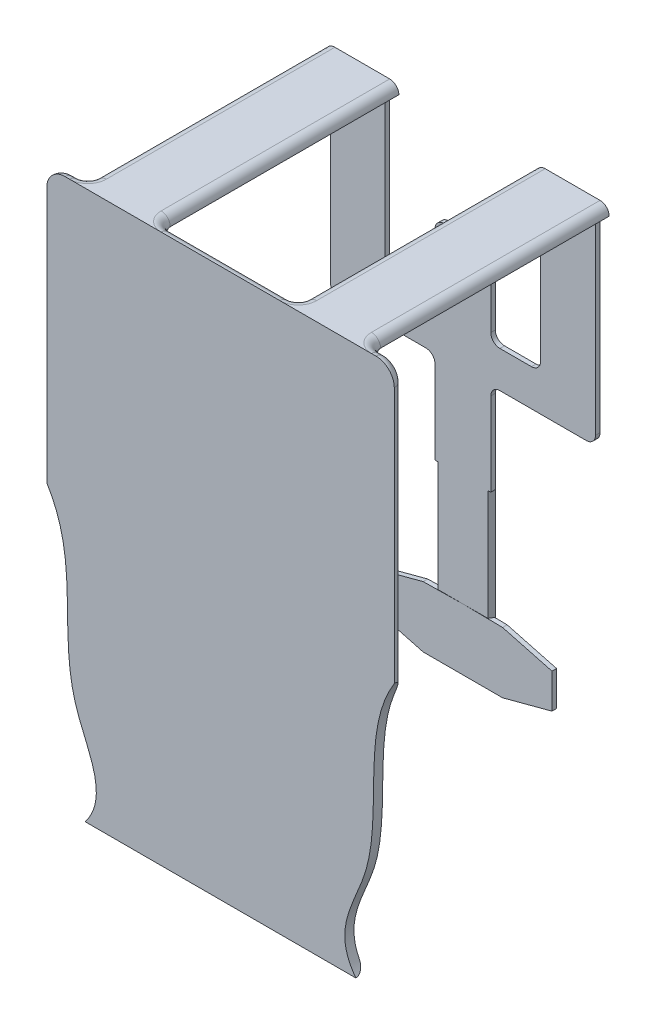
from build123d import *

# Parameters (mm, degrees)
BOSS_EXTRU_1_DEPTH      = 10
ESQUISSE2_W             = 80
ESQUISSE2_H             = 270
BOSS_EXTRU_2_DEPTH      = 10
CONG_1_R                = 10
ENL_V_MAT_EXTRU_1_DEPTH = 447.094160464
ESQUISSE5_W             = 60
ESQUISSE5_H             = 230
BOSS_EXTRU_3_DEPTH      = 5
BOSS_EXTRU_4_DEPTH      = 5
CONG_2_R                = 10
ENL_V_MAT_EXTRU_4_DEPTH = 121
BOSS_EXTRU_5_DEPTH      = 5


with BuildPart() as part:
    # Esquisse1 → Boss.-Extru.1 (new body)
    with BuildSketch(Plane.XY):
        with BuildLine():
            Line((-170, 300), (170, 300))
            ThreePointArc((170, 300), (184.142135624, 294.142135624), (190, 280))
            Line((190, 280), (190, -280))
            ThreePointArc((190, -280), (184.142135624, -294.142135624), (170, -300))
            Line((170, -300), (-170, -300))
            ThreePointArc((-170, -300), (-184.142135624, -294.142135624), (-190, -280))
            Line((-190, -280), (-190, 280))
            ThreePointArc((-190, 280), (-184.142135624, 294.142135624), (-170, 300))
        make_face()
    extrude(amount=BOSS_EXTRU_1_DEPTH)

    # Esquisse2 → Boss.-Extru.2 (add)
    with BuildSketch(Plane(origin=(0, 300, 0), x_dir=(1, 0, 0), z_dir=(0, 1, 0))):
        with Locations((-115, 125)):
            Rectangle(ESQUISSE2_W, ESQUISSE2_H)
        with Locations((115, 125)):
            Rectangle(ESQUISSE2_W, ESQUISSE2_H)
    extrude(amount=-BOSS_EXTRU_2_DEPTH)

    # Congé1
    cong_1_edges = [part.edges().sort_by_distance(p)[0] for p in [
        (-155, 300, -130),
        (-162.5, 300, 0),
        (-184.142135624, 294.142135624, 0),
        (-190, 0, 0),
        (-184.142135624, -294.142135624, 0),
        (0, -300, 0),
        (184.142135624, -294.142135624, 0),
        (190, 0, 0),
        (-75, 300, -130),
        (184.142135624, 294.142135624, 0),
        (0, 300, 0),
        (162.5, 300, 0),
        (75, 300, -130),
        (155, 300, -130),
        (115, 290, 0),
        (-115, 290, 0),
        (-155, 295, 0),
        (155, 295, 0),
        (-75, 295, 0),
        (75, 295, 0),
    ]]
    fillet(cong_1_edges, radius=CONG_1_R - 0.0001)  # a hair under: the kernel refuses the full size

    # Esquisse4 → Enlèv. mat.-Extru.1 (cut, through all)
    with BuildSketch(Plane.XY.offset(10)):
        with BuildLine():
            add(Edge.make_bspline(
                [(-190, 0), (-152.341984932, -61.029808148), (-192.805633878, -171.738289178), (-120.934262628, -264.028864274), (-147.959572806, -300)],
                knots=[0, 0, 0, 0, 0.651486156, 1, 1, 1, 1], degree=3))
            Line((-190, 0), (-190, -280))
            ThreePointArc((-190, -280), (-184.142135624, -294.142135624), (-170, -300))
            Line((-170, -300), (-147.959572806, -300))
        make_face()
        with BuildLine():
            add(Edge.make_bspline(
                [(190, 0), (152.341984932, -61.029808148), (192.805633878, -171.738289178), (120.934262628, -264.028864274), (147.959572806, -300)],
                knots=[0, 0, 0, 0, 0.651486156, 1, 1, 1, 1], degree=3))
            Line((147.959572806, -300), (170, -300))
            ThreePointArc((170, -300), (184.142135624, -294.142135624), (190, -280))
            Line((190, -280), (190, 0))
        make_face()
    extrude(amount=-ENL_V_MAT_EXTRU_1_DEPTH, mode=Mode.SUBTRACT)

    # Esquisse5 → Boss.-Extru.3 (add)
    with BuildSketch(Plane(origin=(0, 0, -260), x_dir=(-1, 0, 0), z_dir=(0, 0, -1))):
        with Locations((-115, 185)):
            Rectangle(ESQUISSE5_W, ESQUISSE5_H)
        with Locations((115, 185)):
            Rectangle(ESQUISSE5_W, ESQUISSE5_H)
    extrude(amount=-BOSS_EXTRU_3_DEPTH)

    # Esquisse6 → Boss.-Extru.4 (add)
    with BuildSketch(Plane(origin=(0, 0, -260), x_dir=(-1, 0, 0), z_dir=(0, 0, -1))):
        Polygon((-145, 110), (-30.5, 110), (-30.5, 197.79553311), (30.5, 197.79553311), (30.5, 110), (145, 110), (145, 70), (30.5, 70), (30.5, -152.20446689), (-30.5, -152.20446689), (-30.5, 70), (-145, 70), align=None)
    extrude(amount=-BOSS_EXTRU_4_DEPTH)

    # Congé2
    cong_2_edges = [part.edges().sort_by_distance(p)[0] for p in [
        (145, 70, -257.5),
        (-145, 70, -257.5),
        (85, 110, -257.5),
        (30.5, 110, -257.5),
        (30.5, 197.79553311, -257.5),
        (-30.5, 197.79553311, -257.5),
        (-85, 110, -257.5),
        (-30.5, 110, -257.5),
        (-30.5, 70, -257.5),
        (30.5, 70, -257.5),
    ]]
    fillet(cong_2_edges, radius=CONG_2_R)

    # Esquisse8 → Enlèv. mat.-Extru.4 (cut)
    with BuildSketch(Plane.XZ.offset(152.20446689)):
        Polygon((-27.46969697, -255), (-30.5, -255), (-30.5, -260), align=None)
        Polygon((30.5, -255), (27.46969697, -255), (30.5, -260), align=None)
    extrude(amount=-ENL_V_MAT_EXTRU_4_DEPTH, mode=Mode.SUBTRACT)


with BuildPart() as body_2:
    # Esquisse9 → Boss.-Extru.5 (new body)
    with BuildSketch(Plane(origin=(0, 0, -260), x_dir=(-1, 0, 0), z_dir=(0, 0, -1))):
        Polygon((-43.402081378, -152.787150642), (0, -152.20446689), (43.402081378, -152.787150642), (97.45133517, -167.14398368), (97.45133517, -205.056801371), (43.402081378, -219.413634409), (-43.402081378, -219.413634409), (-97.45133517, -205.056801371), (-97.45133517, -167.14398368), align=None)
    extrude(amount=-BOSS_EXTRU_5_DEPTH)


solid = Compound([part.part, body_2.part])
